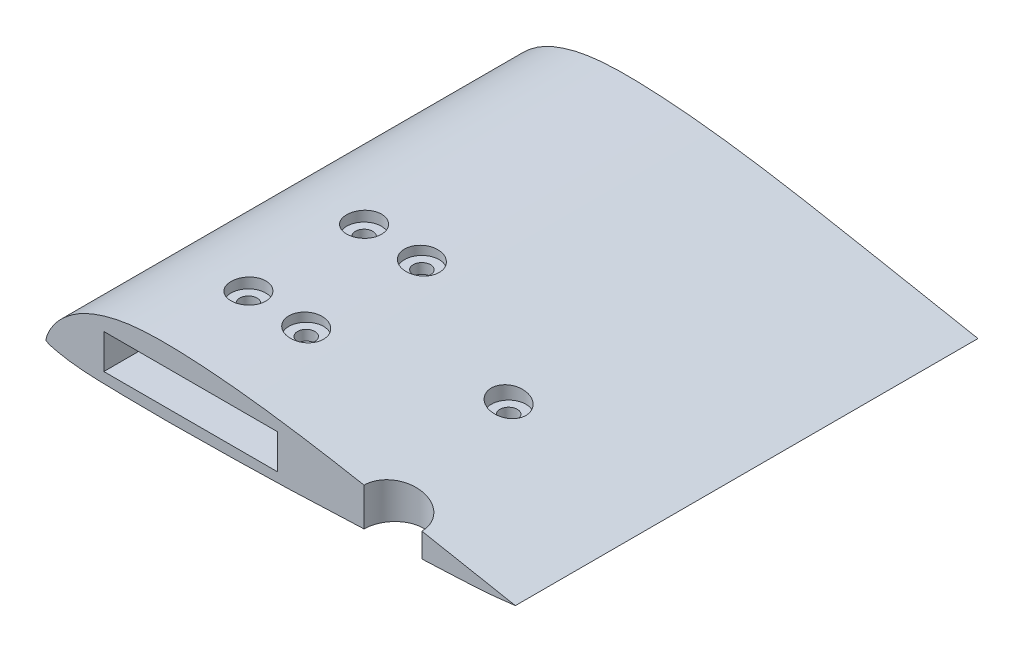
from build123d import *

# Parameters (mm, degrees)
BOSS_EXTRUDE1_DEPTH = 80
SKETCH2_W           = 30
SKETCH2_H           = 6
CUT_EXTRUDE1_DEPTH  = 65
SKETCH4_R           = 3
CUT_EXTRUDE2_DEPTH  = 2
SKETCH5_R           = 1.5
CUT_EXTRUDE3_DEPTH  = 103.13301281
SKETCH6_R           = 3
CUT_EXTRUDE4_DEPTH  = 2.5
SKETCH7_R           = 1.5
CUT_EXTRUDE5_DEPTH  = 102.845539633
SKETCH9_R           = 5
CUT_EXTRUDE7_DEPTH  = 103.342734941


with BuildPart() as part:
    # Sketch1 → Boss-Extrude1 (new body)
    with BuildSketch(Plane.XY):
        with BuildLine():
            add(Edge.make_bspline(
                [(-18.425421956, -0.199386234), (-18.250807896, -0.323162158), (-18.061251473, -0.425770215), (-17.670185963, -0.588457756), (-17.465711902, -0.645601459), (-17.052790666, -0.749031186), (-16.845438283, -0.795723129), (-16.430407626, -0.887271407), (-16.222529395, -0.931001475), (-15.181203322, -1.138753276), (-14.341312978, -1.267122618), (-12.650556873, -1.459475744), (-11.804264349, -1.524473907), (-10.110675675, -1.620252111), (-9.263402235, -1.651806479), (-7.568365601, -1.698217272), (-6.720594376, -1.712799915), (-5.024945614, -1.738340531), (-4.177094139, -1.750187078), (-1.633450933, -1.782699791), (0.062471516, -1.799750734), (3.454891541, -1.810823578), (5.150768282, -1.801632844), (8.541981515, -1.759378036), (10.237459076, -1.732547737), (13.628472558, -1.681466037), (15.323940081, -1.654192162), (18.714547371, -1.585160994), (20.409660153, -1.542211253), (25.494375709, -1.385841233), (28.883521653, -1.251907189), (33.966965859, -1.039852343), (35.661245181, -0.965724), (39.049199178, -0.807164268), (40.742790278, -0.721308769), (44.129735951, -0.545567412), (45.823150322, -0.456700493), (48.363909433, -0.334263902), (49.210947544, -0.29546934), (50.905299484, -0.22257839), (51.752572198, -0.187781414), (54.293931428, -0.075570712), (55.98756657, 0.00953431), (58.523996352, 0.205741697), (59.368748554, 0.283487643), (61.05662502, 0.466719227), (61.899854639, 0.57040966), (62.742799283, 0.678955984)],
                knots=[0, 0, 0, 0, 0.0078125, 0.0078125, 0.015625, 0.015625, 0.0234375, 0.0234375, 0.03125, 0.03125, 0.0625, 0.0625, 0.09375, 0.09375, 0.125, 0.125, 0.15625, 0.15625, 0.1875, 0.1875, 0.25, 0.25, 0.3125, 0.3125, 0.375, 0.375, 0.4375, 0.4375, 0.5, 0.5, 0.625, 0.625, 0.6875, 0.6875, 0.75, 0.75, 0.8125, 0.8125, 0.84375, 0.84375, 0.875, 0.875, 0.9375, 0.9375, 0.96875, 0.96875, 1, 1, 1, 1], degree=3))
            add(Edge.make_bspline(
                [(62.742799283, 0.678955984), (59.228016232, 1.346690435), (55.712968701, 2.012979029), (48.683549713, 3.349252176), (45.169874386, 4.023042331), (38.139561228, 5.354427232), (34.623365404, 6.014438348), (27.573536562, 7.239135005), (24.037646507, 7.80126152), (16.944704989, 8.755941711), (13.387643258, 9.150265434), (8.032519512, 9.54631945), (6.246764718, 9.645982741), (2.673244691, 9.75414868), (0.885486399, 9.762966119), (-1.799340986, 9.631548554), (-2.69384377, 9.562865957), (-4.466165203, 9.356418994), (-5.345533769, 9.217899253), (-7.08766433, 8.854561661), (-7.950631137, 8.630808137), (-9.231353326, 8.223838477), (-9.657185967, 8.075892377), (-10.496192119, 7.756713819), (-11.322643143, 7.413705893), (-12.118306937, 7.012264453), (-12.89532585, 6.575435423), (-13.274602242, 6.339496748), (-14.015735973, 5.834558401), (-14.379278242, 5.56473741), (-15.077798687, 4.99934358), (-15.413136524, 4.703042022), (-16.051740743, 4.079099399), (-16.355555611, 3.751994302), (-16.921071316, 3.056631222), (-17.181810423, 2.684013215), (-17.537584733, 2.1056775), (-17.650688368, 1.909928138), (-17.866695753, 1.512907765), (-17.969146288, 1.311391409), (-18.153831808, 0.897415124), (-18.236273435, 0.684109016), (-18.363283253, 0.250266567), (-18.408240321, 0.028824874), (-18.425421956, -0.199386234)],
                knots=[0, 0, 0, 0, 0.125, 0.125, 0.25, 0.25, 0.375, 0.375, 0.5, 0.5, 0.625, 0.625, 0.6875, 0.6875, 0.75, 0.75, 0.78125, 0.78125, 0.8125, 0.8125, 0.84375, 0.84375, 0.859375, 0.859375, 0.875, 0.890625, 0.890625, 0.90625, 0.90625, 0.921875, 0.921875, 0.9375, 0.9375, 0.953125, 0.953125, 0.96875, 0.96875, 0.9765625, 0.9765625, 0.984375, 0.984375, 0.9921875, 0.9921875, 1, 1, 1, 1], degree=3))
        make_face()
    extrude(amount=BOSS_EXTRUDE1_DEPTH)

    # Sketch2 → Cut-Extrude1 (cut)
    with BuildSketch(Plane.XY.offset(80)):
        with Locations((6.574578044, 3.153105067)):
            Rectangle(SKETCH2_W, SKETCH2_H)
    extrude(amount=-CUT_EXTRUDE1_DEPTH, mode=Mode.SUBTRACT)

    # Sketch4 → Cut-Extrude2 (cut)
    with BuildSketch(Plane(origin=(0, 9.913905067, 0), x_dir=(-1, 0, 0), z_dir=(0, -1, 0))):
        with Locations((-1.574578044, -45)):
            Circle(SKETCH4_R)
        with Locations((-11.574578044, -45)):
            Circle(SKETCH4_R)
        with Locations((-11.574578044, -65)):
            Circle(SKETCH4_R)
        with Locations((-1.574578044, -65)):
            Circle(SKETCH4_R)
    extrude(amount=CUT_EXTRUDE2_DEPTH, mode=Mode.SUBTRACT)

    # Sketch5 → Cut-Extrude3 (cut, through all)
    with BuildSketch(Plane(origin=(0, 7.913905067, 0), x_dir=(1, 0, 0), z_dir=(0, 1, 0))):
        with Locations((1.574578044, -45)):
            Circle(SKETCH5_R)
        with Locations((11.574578044, -45)):
            Circle(SKETCH5_R)
        with Locations((11.574578044, -65)):
            Circle(SKETCH5_R)
        with Locations((1.574578044, -65)):
            Circle(SKETCH5_R)
    extrude(amount=-CUT_EXTRUDE3_DEPTH, mode=Mode.SUBTRACT)

    # Sketch6 → Cut-Extrude4 (cut)
    with BuildSketch(Plane(origin=(0, 6.253105067, 0), x_dir=(-1, 0, 0), z_dir=(0, -1, 0))):
        with Locations((-36.574578044, -55)):
            Circle(SKETCH6_R)
    extrude(amount=CUT_EXTRUDE4_DEPTH, mode=Mode.SUBTRACT)

    # Sketch7 → Cut-Extrude5 (cut, through all)
    with BuildSketch(Plane(origin=(0, 3.753105067, 0), x_dir=(1, 0, 0), z_dir=(0, 1, 0))):
        with Locations((36.574578044, -55)):
            Circle(SKETCH7_R)
    extrude(amount=-CUT_EXTRUDE5_DEPTH, mode=Mode.SUBTRACT)

    # Sketch9 → Cut-Extrude7 (cut, through all)
    with BuildSketch(Plane(origin=(0, 9.913905067, 0), x_dir=(-1, 0, 0), z_dir=(0, -1, 0))):
        with Locations((-41.574578044, -80)):
            Circle(SKETCH9_R)
    extrude(amount=CUT_EXTRUDE7_DEPTH, mode=Mode.SUBTRACT)


solid = part.part
